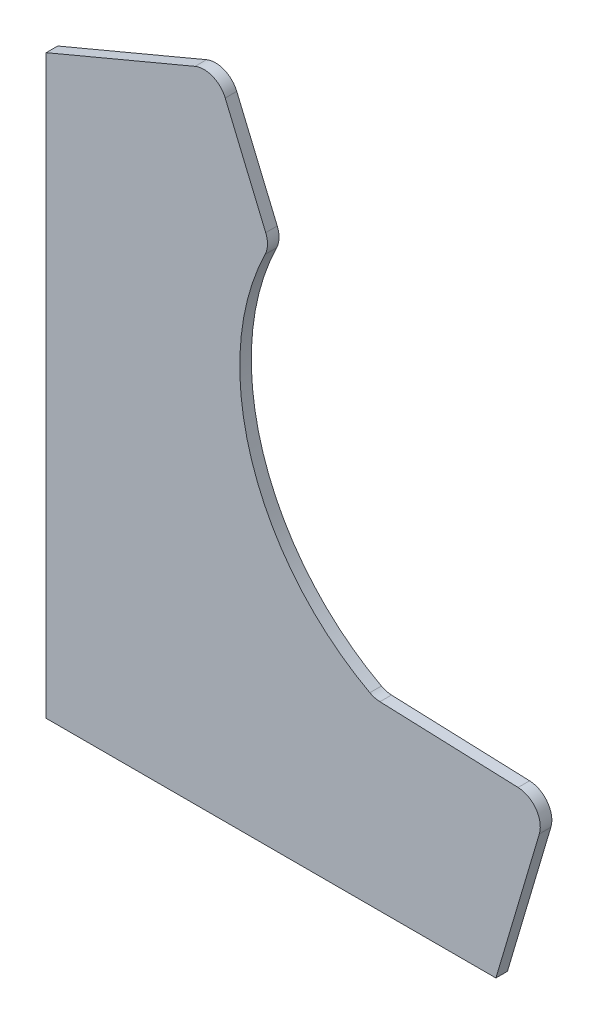
from build123d import *

# Parameters (mm, degrees)
BOSS_EXTRU_1_DEPTH = 10


with BuildPart() as part:
    # Esquisse1 → Boss.-Extru.1 (new body)
    with BuildSketch(Plane.XY):
        with BuildLine():
            Line((0, 0), (0, 500))
            Line((0, 500), (129.062590026, 554.250037842))
            ThreePointArc((129.062590026, 554.250037842), (144.369719008, 554.329896284), (155.249962158, 543.562590026))
            Line((155.249962158, 543.562590026), (190.372911185, 460.003961295))
            ThreePointArc((190.372911185, 460.003961295), (191.926850898, 451.665834452), (189.885391956, 443.433487687))
            ThreePointArc((189.885391956, 443.433487687), (178.082278513, 283.2253099), (280.691033683, 159.623460887))
            ThreePointArc((280.691033683, 159.623460887), (284.926679286, 157.9295184), (289.435995991, 157.239447622))
            Line((289.435995991, 157.239447622), (409.251430669, 152.737046821))
            ThreePointArc((409.251430669, 152.737046821), (424.748921552, 144.41244344), (427.675290566, 127.065754721))
            Line((427.675290566, 127.065754721), (390, 0))
            Line((390, 0), (0, 0))
        make_face()
    extrude(amount=BOSS_EXTRU_1_DEPTH)


solid = part.part
